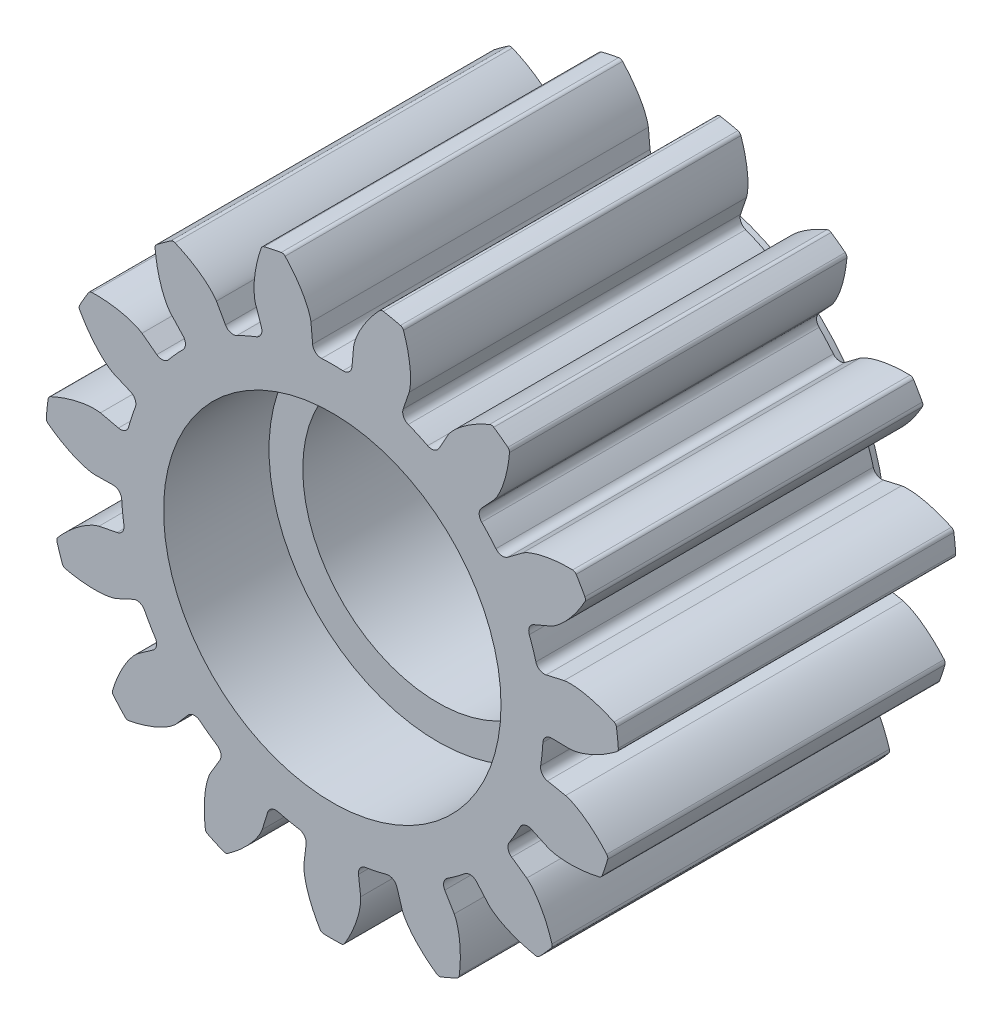
from build123d import *
from build123d.topology import SkipClean

# Parameters (mm, degrees)
SKETCH1_R                            = 10.795
BOSS_EXTRUDE1_DEPTH                  = 12.7
CUT_EXTRUDE_DCLTBC_DEPTH             = 20.858349629
FILLET_DCLTBC_R                      = 0.16191473
CIRPATTERN_DCLTBC_COUNT              = 15
FILLET_DCLTBC_OF_CIRPATTERN_DCLTBC_R = 0.16191473
SKETCH4_R                            = 4.7625
CUT_EXTRUDE2_DEPTH                   = 20.842433323
SKETCH5_R                            = 6.35
CUT_EXTRUDE3_DEPTH                   = 3.96875
SKETCH6_R                            = 5.08
CUT_EXTRUDE4_DEPTH                   = 18.568918178
SKETCH7_R                            = 7.874
SKETCH7_R_2                          = 5.08
BOSS_EXTRUDE2_DEPTH                  = 0.254


with BuildPart() as part:
    # Sketch1 → Boss-Extrude1 (new body)
    with BuildSketch(Plane.XY):
        Circle(SKETCH1_R)
    extrude(amount=BOSS_EXTRUDE1_DEPTH)

    # DCLTBC → Cut-Extrude-DCLTBC (cut, through all)
    with BuildSketch(Plane.XY):
        with BuildLine():
            Line((-0.802818587, 8.914495233), (-0.740427698, 8.221706986))
            ThreePointArc((-0.740427698, 8.221706986), (-0.630257432, 8.006271015), (-0.401522418, 7.927337888))
            ThreePointArc((-0.401522418, 7.927337888), (0, 7.9375), (0.401522418, 7.927337888))
            ThreePointArc((0.401522418, 7.927337888), (0.630257432, 8.006271015), (0.740427698, 8.221706986))
            Line((0.740427698, 8.221706986), (0.802818587, 8.914495233))
            add(Edge.make_bspline(
                [(0.802818587, 8.914495233), (0.803131142, 8.917487435), (0.804139953, 8.925865852), (0.80656879, 8.941647636), (0.811270729, 8.967299615), (0.818345273, 8.999823949), (0.828729071, 9.041652481), (0.842550873, 9.090633409), (0.859399182, 9.144123806), (0.879511081, 9.201922472), (0.901144634, 9.25920993), (0.924178471, 9.315984979), (0.948430292, 9.372191469), (0.979342251, 9.439837066), (1.018538012, 9.520325317), (1.067428746, 9.613428787), (1.12649102, 9.717822762), (1.190507582, 9.822848203), (1.256628492, 9.925038984), (1.326987451, 10.026879137), (1.397578623, 10.124409808), (1.474483108, 10.224171387), (1.547297108, 10.315478376), (1.632781141, 10.415976739), (1.70291362, 10.496562188), (1.778576412, 10.578247549), (1.815874408, 10.617771444), (1.835134193, 10.63787138)],
                knots=[0, 0, 0, 0, 0, 0.005376749, 0.015083688, 0.02853182, 0.04661014, 0.064854849, 0.092110525, 0.119476176, 0.146842496, 0.174208854, 0.201574956, 0.228941013, 0.256307345, 0.307035032, 0.361767352, 0.416499661, 0.471231937, 0.525964282, 0.580696616, 0.635428982, 0.690161387, 0.744893688, 0.799626082, 0.854358408, 0.909090915, 0.909090915, 0.909090915, 0.909090915, 0.909090915], degree=4))
            ThreePointArc((1.835134193, 10.63787138), (0, 10.795), (-1.835134193, 10.63787138))
            add(Edge.make_bspline(
                [(-0.802818587, 8.914495233), (-0.803131142, 8.917487435), (-0.804139953, 8.925865852), (-0.80656879, 8.941647636), (-0.811270729, 8.967299615), (-0.818345273, 8.999823949), (-0.828729071, 9.041652481), (-0.842550873, 9.090633409), (-0.859399182, 9.144123806), (-0.879511081, 9.201922472), (-0.901144634, 9.25920993), (-0.924178471, 9.315984979), (-0.948430292, 9.372191469), (-0.979342251, 9.439837066), (-1.018538012, 9.520325317), (-1.067428746, 9.613428787), (-1.12649102, 9.717822762), (-1.190507582, 9.822848203), (-1.256628492, 9.925038984), (-1.326987451, 10.026879137), (-1.397578623, 10.124409808), (-1.474483108, 10.224171387), (-1.547297108, 10.315478376), (-1.632781141, 10.415976739), (-1.70291362, 10.496562188), (-1.778576412, 10.578247549), (-1.815874408, 10.617771444), (-1.835134193, 10.63787138)],
                knots=[0, 0, 0, 0, 0, 0.005376749, 0.015083688, 0.02853182, 0.04661014, 0.064854849, 0.092110525, 0.119476176, 0.146842496, 0.174208854, 0.201574956, 0.228941013, 0.256307345, 0.307035032, 0.361767352, 0.416499661, 0.471231937, 0.525964282, 0.580696616, 0.635428982, 0.690161387, 0.744893688, 0.799626082, 0.854358408, 0.909090915, 0.909090915, 0.909090915, 0.909090915, 0.909090915], degree=4))
        make_face()
    cut_extrude_dcltbc = extrude(amount=CUT_EXTRUDE_DCLTBC_DEPTH, mode=Mode.SUBTRACT)

    # Fillet-DCLTBC
    fillet_dcltbc_edges = [part.edges().sort_by_distance(p)[0] for p in [
        (1.835134193, 10.63787138, 6.35),
        (-1.835134193, 10.63787138, 6.35),
    ]]
    fillet(fillet_dcltbc_edges, radius=FILLET_DCLTBC_R)

    # CirPattern-DCLTBC: Cut-Extrude-DCLTBC ×15 about axis
    cirpattern_dcltbc_axis = Axis((0, 0, 12.7), (0, 0, 1))
    for i in range(1, CIRPATTERN_DCLTBC_COUNT):
        add(cut_extrude_dcltbc.rotate(cirpattern_dcltbc_axis, i * 360 / CIRPATTERN_DCLTBC_COUNT), mode=Mode.SUBTRACT)

    # Fillet-DCLTBC of CirPattern-DCLTBC
    fillet_dcltbc_of_cirpattern_dcltbc_edges = [part.edges().sort_by_distance(p)[0] for p in [
        (-2.650333588, 10.464595399, 6.35),
        (-6.003290601, 8.971762757, 6.35),
        (-6.677534615, 8.481895806, 6.35),
        (-9.133423525, 5.754354847, 6.35),
        (-9.550129243, 5.032599373, 6.35),
        (-10.684304548, 1.541966708, 6.35),
        (-10.771419764, 0.713120788, 6.35),
        (-10.38777225, -2.937041483, 6.35),
        (-10.130233954, -3.72966286, 6.35),
        (-8.295099761, -6.90820852, 6.35),
        (-7.737438662, -7.527553916, 6.35),
        (-4.768129164, -9.684883545, 6.35),
        (-4.006769933, -10.023862514, 6.35),
        (-0.416705718, -10.78695422, 6.35),
        (0.416705718, -10.78695422, 6.35),
        (4.006769933, -10.023862514, 6.35),
        (4.768129164, -9.684883545, 6.35),
        (7.737438662, -7.527553916, 6.35),
        (8.295099761, -6.90820852, 6.35),
        (10.130233954, -3.72966286, 6.35),
        (10.38777225, -2.937041483, 6.35),
        (10.771419764, 0.713120788, 6.35),
        (10.684304548, 1.541966708, 6.35),
        (9.550129243, 5.032599373, 6.35),
        (9.133423525, 5.754354847, 6.35),
        (6.677534615, 8.481895806, 6.35),
        (6.003290601, 8.971762757, 6.35),
        (2.650333588, 10.464595399, 6.35),
    ]]
    fillet(fillet_dcltbc_of_cirpattern_dcltbc_edges, radius=FILLET_DCLTBC_OF_CIRPATTERN_DCLTBC_R)

    # Sketch4 → Cut-Extrude2 (cut, through all)
    with BuildSketch(Plane.XY.offset(12.7)):
        Circle(SKETCH4_R)
    extrude(amount=-CUT_EXTRUDE2_DEPTH, mode=Mode.SUBTRACT)

    # Sketch5 → Cut-Extrude3 (cut)
    with BuildSketch(Plane.XY.offset(12.7)):
        Circle(SKETCH5_R)
    extrude(amount=-CUT_EXTRUDE3_DEPTH, mode=Mode.SUBTRACT)

    # Sketch6 → Cut-Extrude4 (cut, through all)
    with BuildSketch(Plane.XY.offset(8.73125)):
        Circle(SKETCH6_R)
    extrude(amount=-CUT_EXTRUDE4_DEPTH, mode=Mode.SUBTRACT)

    # Sketch7 → Boss-Extrude2 (add)
    with SkipClean():  # the faces are left unmerged after this step: merging them gives an invalid solid
        with BuildSketch(Plane(origin=(0, 0, 0), x_dir=(-1, 0, 0), z_dir=(0, 0, -1))):
            Circle(SKETCH7_R)
            Circle(SKETCH7_R_2, mode=Mode.SUBTRACT)
        extrude(amount=BOSS_EXTRUDE2_DEPTH)


solid = part.part
